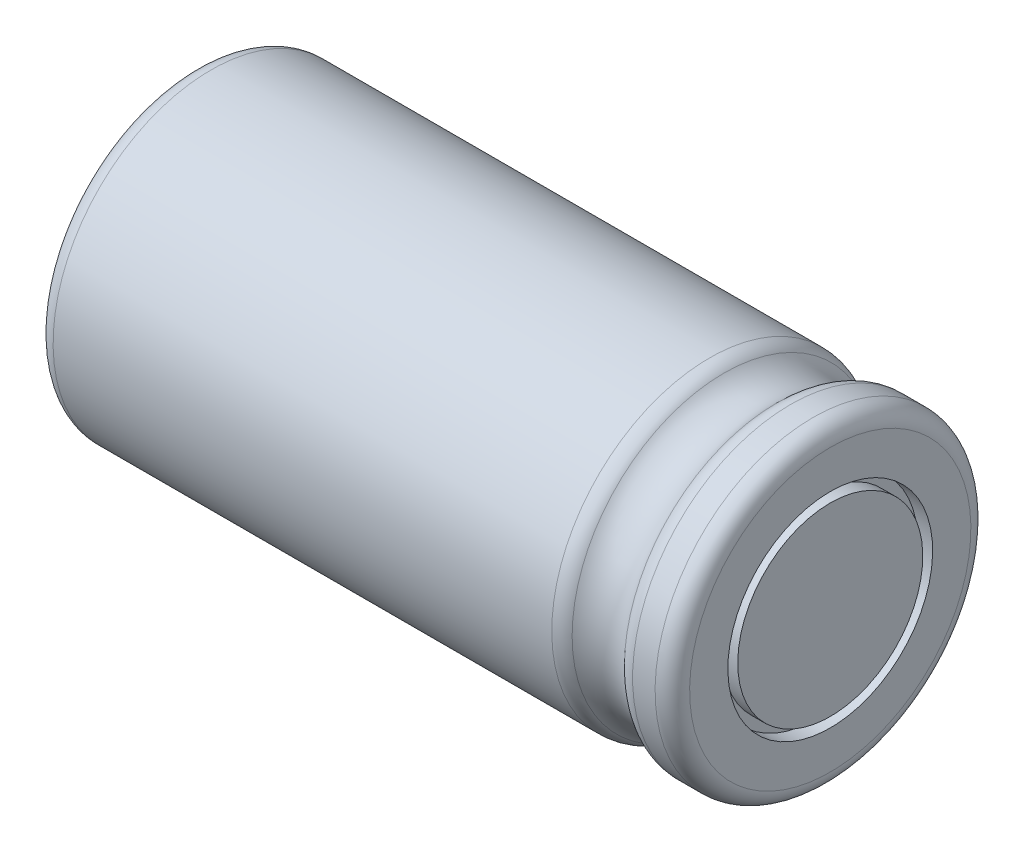
from build123d import *

# Parameters (mm, degrees)
FILLET_1_R          = 0.7
FILLET_4_R          = 0.8
CUT_EXTRUDE_START   = -0.1
CUT_EXTRUDE_3_DEPTH = 0.1


# Read off the part's stored shape, not the designer's step: Вырез-Вытянуть-Тонкостенный3
with BuildPart() as part:
    # Эскиз2 → Повернуть1 (revolve)
    with BuildSketch(Plane.XY):
        with BuildLine():
            Line((0, 0), (0, 4.85))
            Line((0, 4.85), (-0.1, 4.85))
            Line((-0.1, 4.85), (-0.1, 6.4))
            Line((-0.1, 6.4), (21.2, 6.4))
            ThreePointArc((21.2, 6.4), (22.45, 5.7), (23.7, 6.4))
            Line((23.7, 6.4), (25.7, 6.4))
            Line((25.7, 6.4), (25.7, 4.15))
            Line((25.7, 4.15), (25.1, 4.15))
            Line((25.1, 4.15), (25.1, 3.75))
            Line((25.1, 3.75), (25.7, 3.75))
            Line((25.7, 3.75), (25.7, 0))
            Line((25.7, 0), (0, 0))
        make_face()
    revolve(axis=Axis((25.7, 0, 0), (-1, 0, 0)))

    # Скругление1
    fillet_1_edges = [part.edges().sort_by_distance(p)[0] for p in [
        (25.7, -6.4, 0),
        (-0.1, -6.4, 0),
    ]]
    fillet(fillet_1_edges, radius=FILLET_1_R)

    # Скругление4
    fillet_4_edges = [part.edges().sort_by_distance(p)[0] for p in [
        (21.2, -6.4, 0),
        (23.7, -6.4, 0),
    ]]
    fillet(fillet_4_edges, radius=FILLET_4_R)

    # Вырез-Вытянуть-Тонкостенный3 outline → Вырез-Вытянуть-Тонкостенный3 (cut)
    with BuildSketch(Plane.ZY.offset(CUT_EXTRUDE_START)):
        Polygon((-3.872114317, -2.29330127), (0, -0.057735027), (3.872114317, -2.29330127), (3.922114317, -2.20669873), (0.05, 0.028867513), (0.05, 4.5), (-0.05, 4.5), (-0.05, 0.028867513), (-3.922114317, -2.20669873), align=None)
    extrude(amount=CUT_EXTRUDE_3_DEPTH, mode=Mode.SUBTRACT)


solid = part.part
